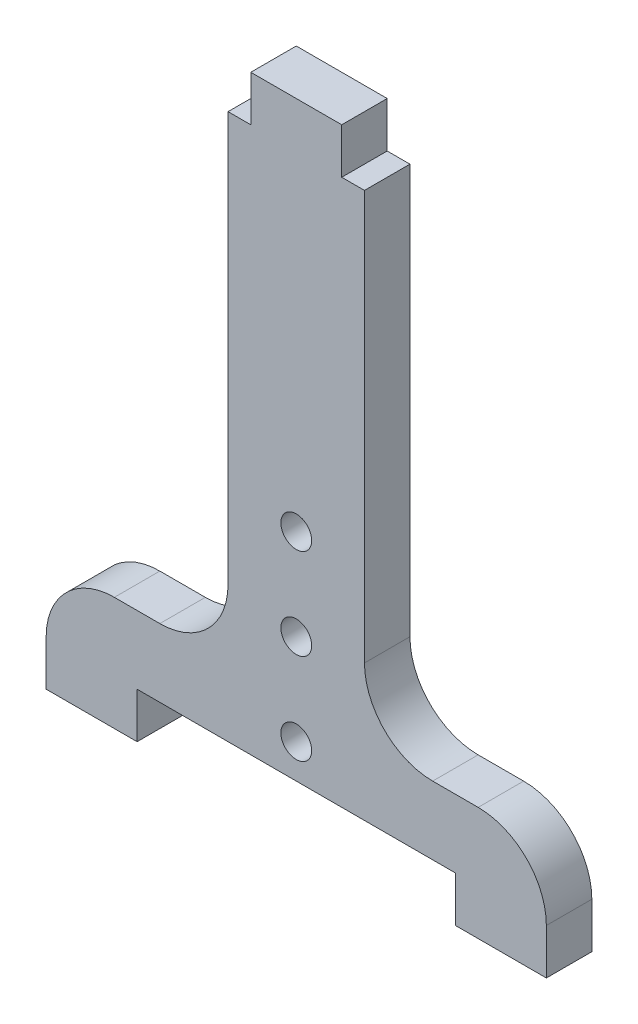
from build123d import *

# Parameters (mm, degrees)
SKETCH1_W             = 69.85
SKETCH1_H             = 76.2
BASE_DEPTH            = 6.35
SKETCH6_W             = 12.7
SKETCH6_H             = 6.35
BOSS_EXTRUDE1_DEPTH   = 6.35
SKETCH7_W             = 25.4
SKETCH7_H             = 66.675
CUT_EXTRUDE1_DEPTH    = 57.884801353
FILLET1_R             = 9.525
F_8_CLEARANCE_HOLE1_D = 4.3053


with BuildPart() as part:
    # Sketch1 → Base (new body)
    with BuildSketch(Plane.XY):
        Rectangle(SKETCH1_W, SKETCH1_H)
    extrude(amount=BASE_DEPTH)

    # Sketch6 → Boss-Extrude1 (add)
    with BuildSketch(Plane.XY.offset(6.35)):
        with Locations((0, 41.275)):
            Rectangle(SKETCH6_W, SKETCH6_H)
        with Locations((28.575, -41.275)):
            Rectangle(SKETCH6_W, SKETCH6_H)
        with Locations((-28.575, -41.275)):
            Rectangle(SKETCH6_W, SKETCH6_H)
    extrude(amount=-BOSS_EXTRUDE1_DEPTH)

    # Sketch7 → Cut-Extrude1 (cut, through all)
    with BuildSketch(Plane.XY.offset(6.35)):
        with Locations((-22.225, 4.7625)):
            Rectangle(SKETCH7_W, SKETCH7_H)
        with Locations((22.225, 4.7625)):
            Rectangle(SKETCH7_W, SKETCH7_H)
    extrude(amount=-CUT_EXTRUDE1_DEPTH, mode=Mode.SUBTRACT)

    # Fillet1
    fillet1_edges = [part.edges().sort_by_distance(p)[0] for p in [
        (9.525, -28.575, 3.175),
        (-9.525, -28.575, 3.175),
        (34.925, -28.575, 3.175),
        (-34.925, -28.575, 3.175),
    ]]
    fillet(fillet1_edges, radius=FILLET1_R)

    # #8 Clearance Hole1 (through all)
    with Locations(Plane(origin=(0, 0, 0), x_dir=(-1, 0, 0), z_dir=(0, 0, -1))):
        with Locations((0, -33.3375), (0, -20.6375), (0, -7.9375)):
            Hole(F_8_CLEARANCE_HOLE1_D / 2)


solid = part.part
